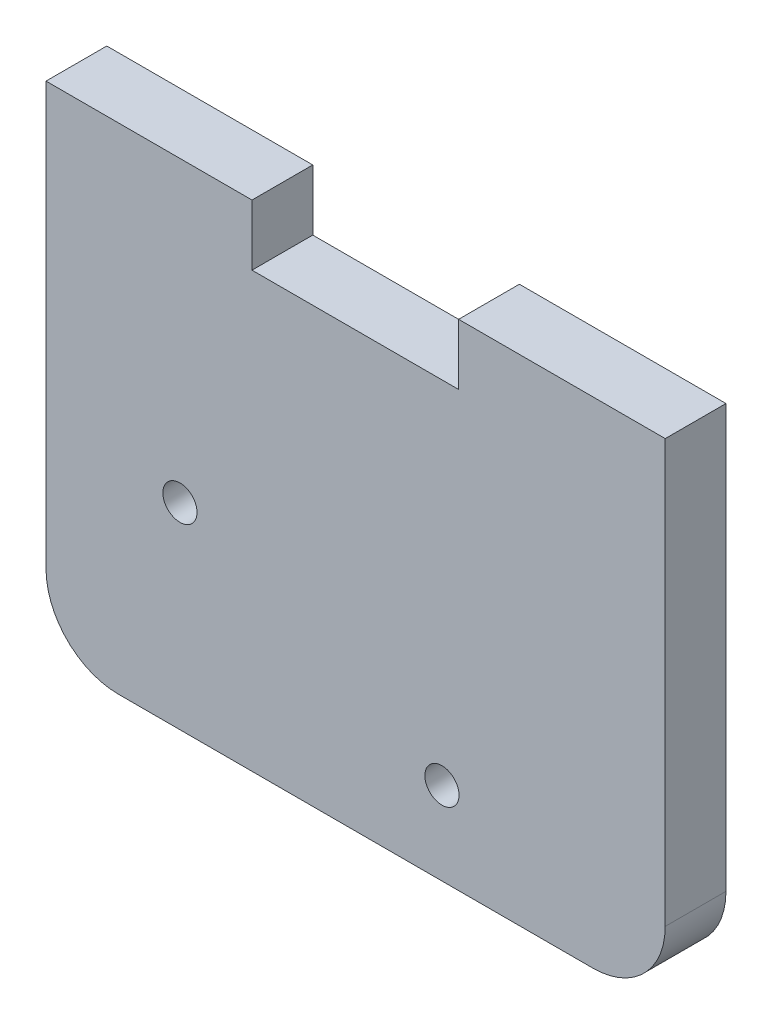
from build123d import *

# Parameters (mm, degrees)
SKETCH1_W           = 54.356
SKETCH1_H           = 43.434
BOSS_EXTRUDE1_DEPTH = 5.334
SKETCH2_W           = 18.137033298
SKETCH2_H           = 5.334
CUT_EXTRUDE1_DEPTH  = 41.016719041
FILLET1_R           = 6.35
SKETCH3_R           = 1.5
CUT_EXTRUDE3_DEPTH  = 41.016719041


with BuildPart() as part:
    # Sketch1 → Boss-Extrude1 (new body)
    with BuildSketch(Plane.XY):
        with Locations((-3.35450847, 3.594107707)):
            Rectangle(SKETCH1_W, SKETCH1_H)
    extrude(amount=BOSS_EXTRUDE1_DEPTH)

    # Sketch2 → Cut-Extrude1 (cut, through all)
    with BuildSketch(Plane.XY.offset(5.334)):
        with Locations((-3.382058417, 22.644107707)):
            Rectangle(SKETCH2_W, SKETCH2_H)
    extrude(amount=-CUT_EXTRUDE1_DEPTH, mode=Mode.SUBTRACT)

    # Fillet1
    fillet1_edges = [part.edges().sort_by_distance(p)[0] for p in [
        (-30.53250847, -18.122892293, 2.667),
        (23.82349153, -18.122892293, 2.667),
    ]]
    fillet(fillet1_edges, radius=FILLET1_R)

    # Sketch3 → Cut-Extrude3 (cut, through all)
    with BuildSketch(Plane.XY.offset(5.334)):
        with Locations((-18.775410686, -0.856094215)):
            Circle(SKETCH3_R)
        with Locations((4.224589314, -10.856094215)):
            Circle(SKETCH3_R)
    extrude(amount=-CUT_EXTRUDE3_DEPTH, mode=Mode.SUBTRACT)


solid = part.part
